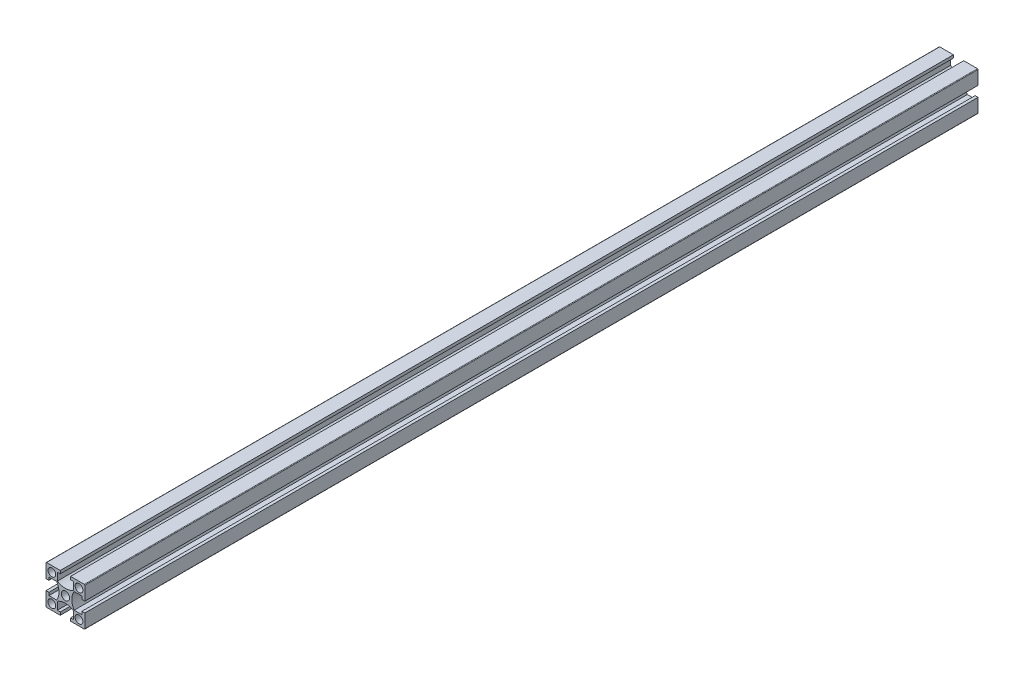
from build123d import *

# Parameters (mm, degrees)
SKETCH_1_W               = 20
SKETCH_1_H               = 20
SKETCH_1_R               = 2
SKETCH_1_R_2             = 2.15
EXTRUDE_1_DEPTH          = 460
CUT_EXTRUDE_1_REACH      = 462.217
PATTERN_CIRCULAR_1_COUNT = 4
FILLET_1_R               = 0.3


with BuildPart() as part:
    # 스케치1 → 보스-돌출1 (new body)
    with BuildSketch(Plane.XY):
        Rectangle(SKETCH_1_W, SKETCH_1_H)
        with Locations((-7, -7)):
            Circle(SKETCH_1_R, mode=Mode.SUBTRACT)
        with Locations((7, -7)):
            Circle(SKETCH_1_R, mode=Mode.SUBTRACT)
        with Locations((-7, 7)):
            Circle(SKETCH_1_R, mode=Mode.SUBTRACT)
        Circle(SKETCH_1_R_2, mode=Mode.SUBTRACT)
        with Locations((7, 7)):
            Circle(SKETCH_1_R, mode=Mode.SUBTRACT)
    extrude(amount=EXTRUDE_1_DEPTH)

    # 스케치1<3> → 컷-돌출1 (cut, up to next)
    with BuildSketch(Plane.XY, mode=Mode.PRIVATE) as cut_extrude_1_sk1:
        with BuildLine():
            Line((-8.5, 2.65), (-10, 2.65))
            Line((-10, 2.65), (-10, -2.65))
            Line((-10, -2.65), (-8.5, -2.65))
            Line((-8.5, -2.65), (-8.5, -4.15))
            Line((-8.5, -4.15), (-4.503166667, -4.15))
            ThreePointArc((-4.503166667, -4.15), (-3.3, 0), (-4.503166667, 4.15))
            Line((-4.503166667, 4.15), (-8.5, 4.15))
            Line((-8.5, 4.15), (-8.5, 2.65))
        make_face()
    cut_extrude_1_tool1 = extrude(cut_extrude_1_sk1.sketch, amount=CUT_EXTRUDE_1_REACH, mode=Mode.PRIVATE) & part.part
    cut_extrude_1 = cut_extrude_1_tool1.solids().sort_by_distance((-6.606913, 0, 0))[0]
    add(cut_extrude_1, mode=Mode.SUBTRACT)

    # 원형 패턴1: 컷-돌출1 ×4 about axis
    pattern_circular_1_axis = Axis((0, 0, 460), (0, 0, -1))
    for i in range(1, PATTERN_CIRCULAR_1_COUNT):
        add(cut_extrude_1.rotate(pattern_circular_1_axis, i * 360 / PATTERN_CIRCULAR_1_COUNT), mode=Mode.SUBTRACT)

    # 필렛1
    fillet_1_edges = [part.edges().sort_by_distance(p)[0] for p in [
        (10, -10, 230),
        (-10, -10, 230),
        (-10, 10, 230),
        (10, 10, 230),
    ]]
    fillet(fillet_1_edges, radius=FILLET_1_R)


solid = part.part
